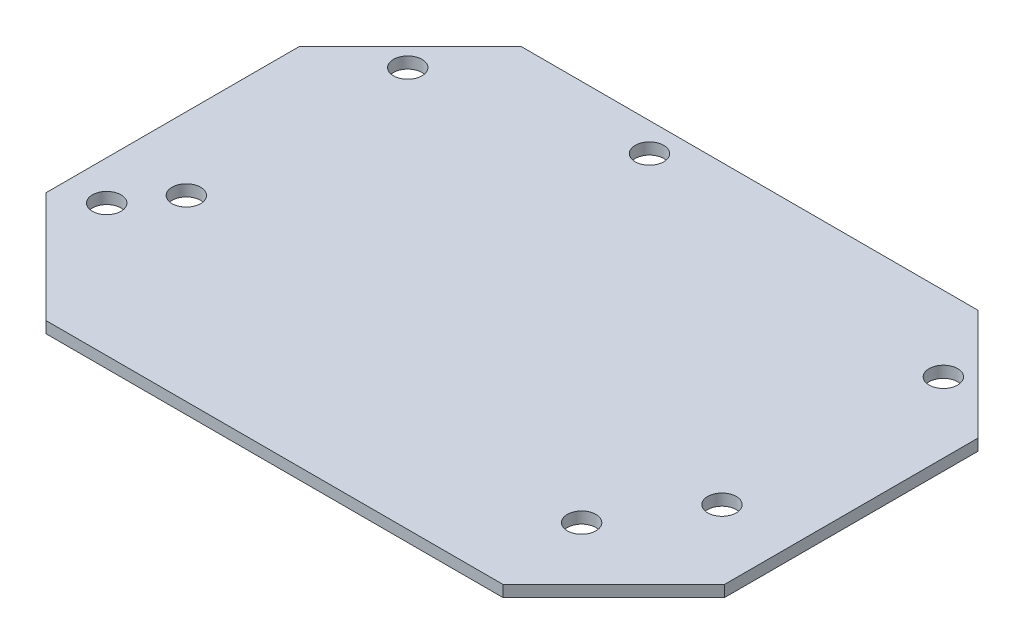
from build123d import *

# Parameters (mm, degrees)
BOSS_EXTRUDE1_DEPTH = 1.6
SKETCH2_R           = 2
CUT_EXTRUDE1_DEPTH  = 116.973315896
CUT_EXTRUDE2_REACH  = 117.973
SKETCH3_R           = 2


with BuildPart() as part:
    # Sketch1 → Boss-Extrude1 (new body)
    with BuildSketch(Plane(origin=(0, 0, 0), x_dir=(1, 0, 0), z_dir=(0, 1, 0))):
        Polygon((0, 15.5), (15.5, 0), (79.5, 0), (95, 15.5), (95, 51), (79.5, 66.5), (15.5, 66.5), (0, 51), align=None)
    extrude(amount=BOSS_EXTRUDE1_DEPTH)

    # Sketch2 → Cut-Extrude1 (cut, through all)
    with BuildSketch(Plane(origin=(0, 1.6, 0), x_dir=(1, 0, 0), z_dir=(0, 1, 0))):
        with Locations((5.5, 18.5)):
            Circle(SKETCH2_R)
        with Locations((77.5, 13)):
            Circle(SKETCH2_R)
        with Locations((37.5, 62.5)):
            Circle(SKETCH2_R)
    extrude(amount=-CUT_EXTRUDE1_DEPTH, mode=Mode.SUBTRACT)

    # Sketch3 → Cut-Extrude2 (cut, up to next)
    with BuildSketch(Plane(origin=(0, 1.6, 0), x_dir=(1, 0, 0), z_dir=(0, 1, 0)), mode=Mode.PRIVATE) as cut_extrude2_sk1:
        with Locations((10.15, 56)):
            Circle(SKETCH3_R)
    cut_extrude2_tool1 = extrude(cut_extrude2_sk1.sketch, amount=-CUT_EXTRUDE2_REACH, mode=Mode.PRIVATE) & part.part
    # Sketch3 → Cut-Extrude2 (cut, up to next)
    with BuildSketch(Plane(origin=(0, 1.6, 0), x_dir=(1, 0, 0), z_dir=(0, 1, 0)), mode=Mode.PRIVATE) as cut_extrude2_sk2:
        with Locations((85.15, 56)):
            Circle(SKETCH3_R)
    cut_extrude2_tool2 = extrude(cut_extrude2_sk2.sketch, amount=-CUT_EXTRUDE2_REACH, mode=Mode.PRIVATE) & part.part
    # Sketch3 → Cut-Extrude2 (cut, up to next)
    with BuildSketch(Plane(origin=(0, 1.6, 0), x_dir=(1, 0, 0), z_dir=(0, 1, 0)), mode=Mode.PRIVATE) as cut_extrude2_sk3:
        with Locations((85.15, 25)):
            Circle(SKETCH3_R)
    cut_extrude2_tool3 = extrude(cut_extrude2_sk3.sketch, amount=-CUT_EXTRUDE2_REACH, mode=Mode.PRIVATE) & part.part
    # Sketch3 → Cut-Extrude2 (cut, up to next)
    with BuildSketch(Plane(origin=(0, 1.6, 0), x_dir=(1, 0, 0), z_dir=(0, 1, 0)), mode=Mode.PRIVATE) as cut_extrude2_sk4:
        with Locations((10.15, 25)):
            Circle(SKETCH3_R)
    cut_extrude2_tool4 = extrude(cut_extrude2_sk4.sketch, amount=-CUT_EXTRUDE2_REACH, mode=Mode.PRIVATE) & part.part
    add(cut_extrude2_tool1.solids().sort_by_distance((10.15, 1.6, -56))[0], mode=Mode.SUBTRACT)
    add(cut_extrude2_tool2.solids().sort_by_distance((85.15, 1.6, -56))[0], mode=Mode.SUBTRACT)
    add(cut_extrude2_tool3.solids().sort_by_distance((85.15, 1.6, -25))[0], mode=Mode.SUBTRACT)
    add(cut_extrude2_tool4.solids().sort_by_distance((10.15, 1.6, -25))[0], mode=Mode.SUBTRACT)


solid = part.part
